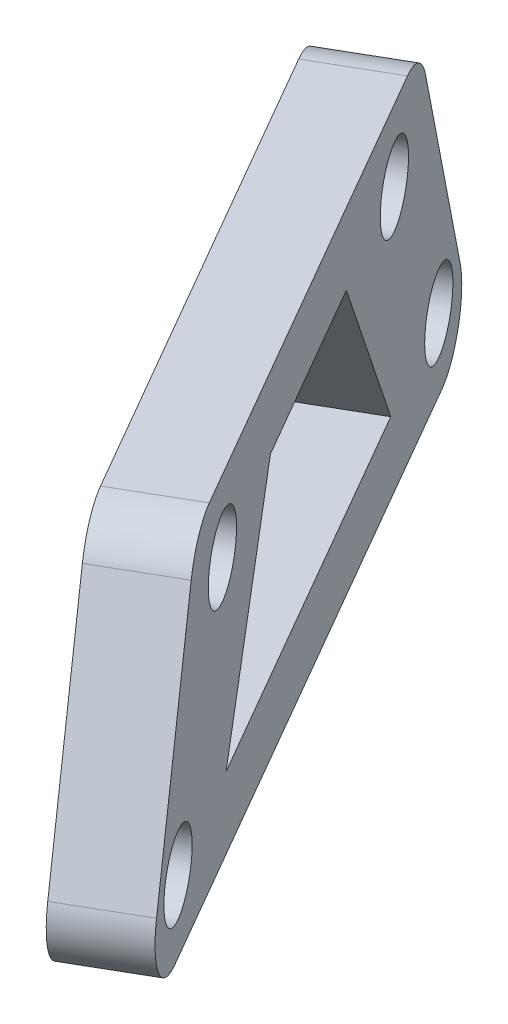
from build123d import *

# Parameters (mm, degrees)
SKETCH1_R           = 2.15
BOSS_EXTRUDE1_DEPTH = 4.45
FILLET1_R           = 3


with BuildPart() as part:
    # Sketch1 → Boss-Extrude1 (new body)
    with BuildSketch(Plane(origin=(-13.195581417, 0, 7.618472483), x_dir=(0.4999999999999981, 0, 0.8660254037844397), z_dir=(-0.8660254037844397, 0, 0.4999999999999981))):
        Polygon((-25.134165871, 118.055853922), (-17.360832538, 136.798849573), (16.885834129, 136.798849573), (24.659167462, 118.055853922), align=None)
        with Locations((-13.360832538, 132.798849573)):
            Circle(SKETCH1_R, mode=Mode.SUBTRACT)
        with Locations((12.885834129, 132.798849573)):
            Circle(SKETCH1_R, mode=Mode.SUBTRACT)
        with Locations((19.659167462, 122.055853922)):
            Circle(SKETCH1_R, mode=Mode.SUBTRACT)
        with Locations((-20.134165871, 122.055853922)):
            Circle(SKETCH1_R, mode=Mode.SUBTRACT)
        Polygon((-12.804739093, 122.055853922), (-6.03140576, 132.798849573), (5.556407351, 132.798849573), (12.329740684, 122.055853922), align=None, mode=Mode.SUBTRACT)
    extrude(amount=-BOSS_EXTRUDE1_DEPTH)

    # Fillet1
    fillet1_edges = [part.edges().sort_by_distance(p)[0] for p in [
        (1.060908838, 118.055853922, 27.861437942),
        (-2.825757829, 136.798849573, 21.129533803),
        (-19.949091162, 136.798849573, -8.528949525),
        (-23.835757829, 118.055853922, -15.260853664),
    ]]
    fillet(fillet1_edges, radius=FILLET1_R)


solid = part.part
